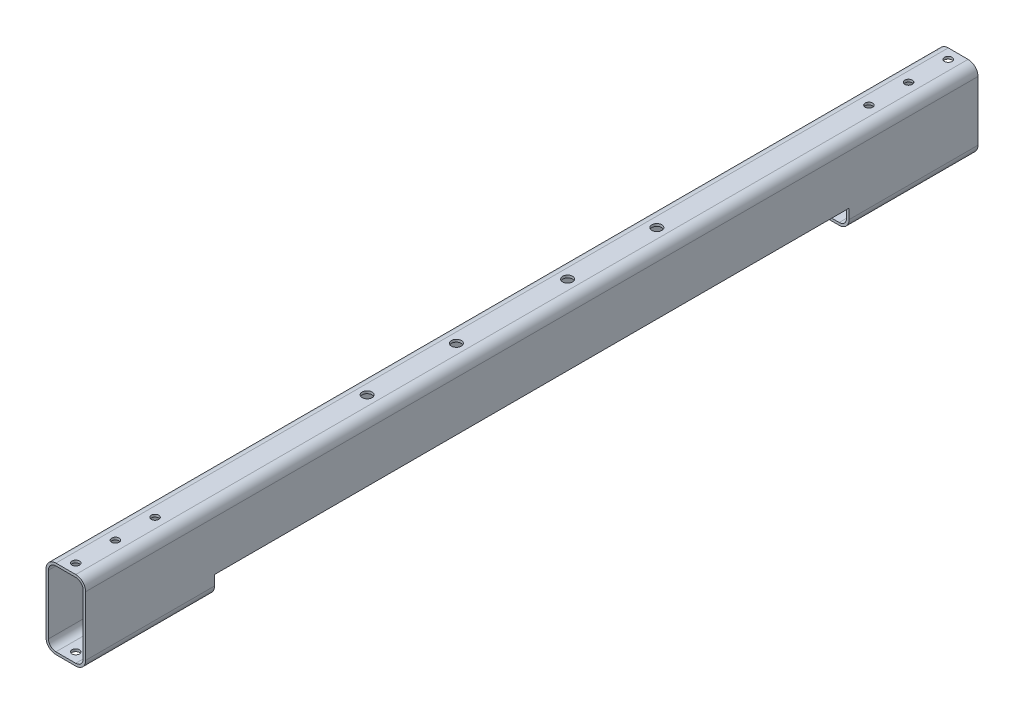
from build123d import *

# Parameters (mm, degrees)
EXTRUDE_THIN1_DEPTH            = 571.5
F_3_16_0_1875_DIAMETER_HOLE1_D = 4.7625
SKETCH5_W                      = 406.4
SKETCH5_H                      = 12.7
CUT_EXTRUDE1_DEPTH             = 573.627776134
F_1_4_0_25_DIAMETER_HOLE1_D    = 6.35


with BuildPart() as part:
    # Sketch1 → Extrude-Thin1 (new body)
    with BuildSketch(Plane.XY):
        with BuildLine():
            Line((-12.7, 19.05), (-12.7, -19.05))
            ThreePointArc((-12.7, -19.05), (-10.840128061, -23.540128061), (-6.35, -25.4))
            Line((-6.35, -25.4), (6.35, -25.4))
            ThreePointArc((6.35, -25.4), (10.840128061, -23.540128061), (12.7, -19.05))
            Line((12.7, -19.05), (12.7, 19.05))
            ThreePointArc((12.7, 19.05), (10.840128061, 23.540128061), (6.35, 25.4))
            Line((6.35, 25.4), (-6.35, 25.4))
            ThreePointArc((-6.35, 25.4), (-10.840128061, 23.540128061), (-12.7, 19.05))
        make_face()
        with BuildLine():
            Line((-11.1125, 19.05), (-11.1125, -19.05))
            ThreePointArc((-11.1125, -19.05), (-9.717596045, -22.417596045), (-6.35, -23.8125))
            Line((-6.35, -23.8125), (6.35, -23.8125))
            ThreePointArc((6.35, -23.8125), (9.717596045, -22.417596045), (11.1125, -19.05))
            Line((11.1125, -19.05), (11.1125, 19.05))
            ThreePointArc((11.1125, 19.05), (9.717596045, 22.417596045), (6.35, 23.8125))
            Line((6.35, 23.8125), (-6.35, 23.8125))
            ThreePointArc((-6.35, 23.8125), (-9.717596045, 22.417596045), (-11.1125, 19.05))
        make_face(mode=Mode.SUBTRACT)
    extrude(amount=EXTRUDE_THIN1_DEPTH)

    # 3/16 (0.1875) Diameter Hole1 (through all)
    with Locations(Plane(origin=(0, 25.4, 565.15), x_dir=(0, 0, 1), z_dir=(0, 1, 0))):
        with Locations((0, 0), (-558.8, 0), (-533.4, 0), (-508, 0), (-25.4, 0), (-50.8, 0)):
            Hole(F_3_16_0_1875_DIAMETER_HOLE1_D / 2)

    # Sketch5 → Cut-Extrude1 (cut, through all)
    with BuildSketch(Plane(origin=(12.7, 0, 0), x_dir=(0, 0, -1), z_dir=(1, 0, 0))):
        with Locations((-285.75, -19.05)):
            Rectangle(SKETCH5_W, SKETCH5_H)
    extrude(amount=-CUT_EXTRUDE1_DEPTH, mode=Mode.SUBTRACT)

    # 1/4 (0.25) Diameter Hole1 (through all)
    with Locations(Plane(origin=(0, 25.4, 0), x_dir=(1, 0, 0), z_dir=(0, 1, 0))):
        with Locations((0, -321.3735), (0, -378.5235), (0, -192.9765), (0, -250.1265)):
            Hole(F_1_4_0_25_DIAMETER_HOLE1_D / 2)


solid = part.part
